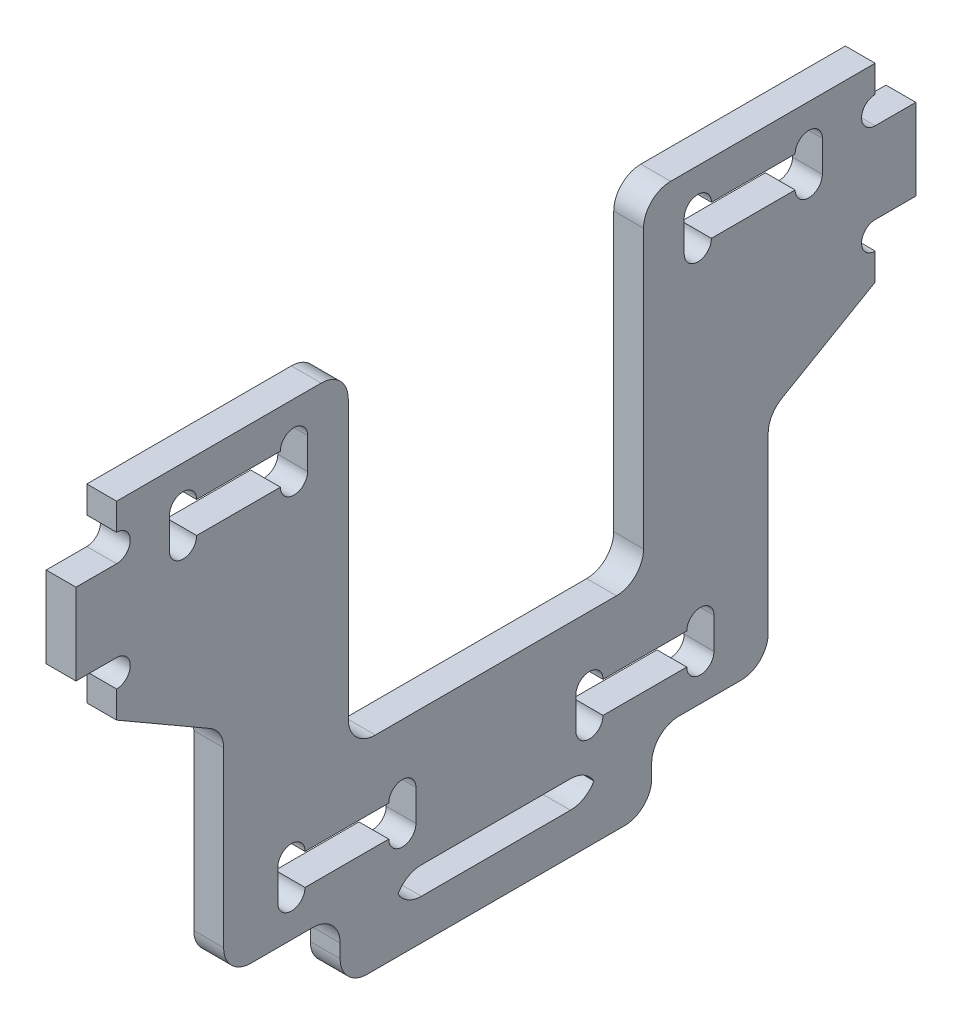
from build123d import *

# Parameters (mm, degrees)
EXTRUDE_1_DEPTH = 2.2
EXTRUDE_2_DEPTH = 2.2
FILLET_1_R      = 2


with BuildPart() as part:
    # 草图1 → 凸台-拉伸1 (new body)
    with BuildSketch(Plane(origin=(0, 0, 0), x_dir=(0, 0, -1), z_dir=(1, 0, 0))):
        with BuildLine():
            Line((-20.1, -17.25), (20.1, -17.25))
            Line((20.1, -17.25), (20.1, -1.311067127))
            Line((20.1, -1.311067127), (28, 3.25))
            Line((28, 3.25), (28, 5.24))
            ThreePointArc((28, 5.24), (26.995, 6.245), (28, 7.25))
            Line((28, 7.25), (31, 7.25))
            Line((31, 7.25), (31, 13.25))
            Line((31, 13.25), (28, 13.25))
            ThreePointArc((28, 13.25), (26.995, 14.255), (28, 15.26))
            Line((28, 15.26), (28, 17.25))
            Line((28, 17.25), (10.9, 17.25))
            Line((10.9, 17.25), (10.9, -7.25))
            Line((10.9, -7.25), (-10.9, -7.25))
            Line((-10.9, -7.25), (-10.9, 17.25))
            Line((-10.9, 17.25), (-28, 17.25))
            Line((-28, 17.25), (-28, 15.26))
            ThreePointArc((-28, 15.26), (-27.289357685, 14.965642315), (-26.995, 14.255))
            ThreePointArc((-26.995, 14.255), (-27.289357685, 13.544357685), (-28, 13.25))
            Line((-28, 13.25), (-31, 13.25))
            Line((-31, 13.25), (-31, 7.25))
            Line((-31, 7.25), (-28, 7.25))
            ThreePointArc((-28, 7.25), (-27.289357685, 6.955642315), (-26.995, 6.245))
            ThreePointArc((-26.995, 6.245), (-27.289357685, 5.534357685), (-28, 5.24))
            Line((-28, 5.24), (-28, 3.25))
            Line((-28, 3.25), (-20.1, -1.311067127))
            Line((-20.1, -1.311067127), (-20.1, -17.25))
        make_face()
        with BuildLine():
            Line((-7.91, -14.4), (-14.09, -14.4))
            ThreePointArc((-14.09, -14.4), (-15.095, -15.405), (-16.1, -14.4))
            Line((-16.1, -14.4), (-16.1, -12.1))
            ThreePointArc((-16.1, -12.1), (-15.095, -11.095), (-14.09, -12.1))
            Line((-14.09, -12.1), (-7.91, -12.1))
            ThreePointArc((-7.91, -12.1), (-6.905, -11.095), (-5.9, -12.1))
            Line((-5.9, -12.1), (-5.9, -14.4))
            ThreePointArc((-5.9, -14.4), (-6.905, -15.405), (-7.91, -14.4))
        make_face(mode=Mode.SUBTRACT)
        with BuildLine():
            Line((16.1, -12.1), (16.1, -14.4))
            ThreePointArc((16.1, -14.4), (15.095, -15.405), (14.09, -14.4))
            Line((14.09, -14.4), (7.91, -14.4))
            ThreePointArc((7.91, -14.4), (6.905, -15.405), (5.9, -14.4))
            Line((5.9, -14.4), (5.9, -12.1))
            ThreePointArc((5.9, -12.1), (6.905, -11.095), (7.91, -12.1))
            Line((7.91, -12.1), (14.09, -12.1))
            ThreePointArc((14.09, -12.1), (15.095, -11.095), (16.1, -12.1))
        make_face(mode=Mode.SUBTRACT)
        with BuildLine():
            Line((-15.91, 12.1), (-22.09, 12.1))
            ThreePointArc((-22.09, 12.1), (-23.095, 11.095), (-24.1, 12.1))
            Line((-24.1, 12.1), (-24.1, 14.4))
            ThreePointArc((-24.1, 14.4), (-23.095, 15.405), (-22.09, 14.4))
            Line((-22.09, 14.4), (-15.91, 14.4))
            ThreePointArc((-15.91, 14.4), (-14.905, 15.405), (-13.9, 14.4))
            Line((-13.9, 14.4), (-13.9, 12.1))
            ThreePointArc((-13.9, 12.1), (-14.905, 11.095), (-15.91, 12.1))
        make_face(mode=Mode.SUBTRACT)
        with BuildLine():
            Line((13.9, 12.1), (13.9, 14.4))
            ThreePointArc((13.9, 14.4), (14.905, 15.405), (15.91, 14.4))
            Line((15.91, 14.4), (22.09, 14.4))
            ThreePointArc((22.09, 14.4), (23.095, 15.405), (24.1, 14.4))
            Line((24.1, 14.4), (24.1, 12.1))
            ThreePointArc((24.1, 12.1), (23.095, 11.095), (22.09, 12.1))
            Line((22.09, 12.1), (15.91, 12.1))
            ThreePointArc((15.91, 12.1), (14.905, 11.095), (13.9, 12.1))
        make_face(mode=Mode.SUBTRACT)
    extrude(amount=EXTRUDE_1_DEPTH)

    # 草图2 → 凸台-拉伸2 (add)
    with BuildSketch(Plane(origin=(2.2, 0, 0), x_dir=(0, 0, -1), z_dir=(1, 0, 0))):
        Polygon((-11.5, -17.25), (-11.5, -22.25), (11.5, -22.25), (11.5, -17.25), (7.5, -17.25), (7.5, -19.26), (-7.5, -19.26), (-7.5, -17.25), align=None)
    extrude(amount=-EXTRUDE_2_DEPTH)

    # 圆角1
    # the kernel refuses this fillet: 2 mm, written as the material it adds along each edge
    with BuildSketch(Plane(origin=(0, -1.311067127, -20.1), x_dir=(0, -1, 0), z_dir=(1, 0, 0)), Plane(origin=(0, -1.311067127, 20.1), x_dir=(0, 0.49999999999999634, 0.8660254037844408), z_dir=(1, 0, 0))) as fillet_1_piece_1:
        with BuildLine():
            CenterArc((FILLET_1_R * 0.57735026919, FILLET_1_R), FILLET_1_R, 210, 60)
            Line((-FILLET_1_R * 0.288675134595, FILLET_1_R * 0.5), (0, 0))
            Line((0, 0), (FILLET_1_R * 0.57735026919, 0))
        make_face()
    extrude(amount=2.2)
    with BuildSketch(Plane(origin=(0, -7.25, -10.9), x_dir=(0, 1, 0), z_dir=(1, 0, 0)), Plane(origin=(0, -7.25, 10.9), x_dir=(0, 0, -1), z_dir=(1, 0, 0)), Plane(origin=(2.2, -17.25, 7.5), x_dir=(0, 0, -1), z_dir=(-1, 0, 0)), Plane(origin=(2.2, -17.25, -11.5), x_dir=(0, 0, -1), z_dir=(-1, 0, 0))) as fillet_1_piece_2:
        with BuildLine():
            CenterArc((FILLET_1_R, FILLET_1_R), FILLET_1_R, 180, 90)
            Line((0, FILLET_1_R), (0, 0))
            Line((0, 0), (FILLET_1_R, 0))
        make_face()
    extrude(amount=2.2)
    with BuildSketch(Plane(origin=(2.2, -19.26, -7.5), x_dir=(0, 1, 0), z_dir=(-1, 0, 0)), Plane(origin=(2.2, -19.26, 7.5), x_dir=(0, 0, -1), z_dir=(-1, 0, 0)), Plane(origin=(2.2, -17.25, -7.5), x_dir=(0, 0, 1), z_dir=(-1, 0, 0)), Plane(origin=(2.2, -17.25, 11.5), x_dir=(0, 0, 1), z_dir=(-1, 0, 0))) as fillet_1_piece_3:
        with BuildLine():
            CenterArc((FILLET_1_R, -FILLET_1_R), FILLET_1_R, 90, 90)
            Line((0, -FILLET_1_R), (0, 0))
            Line((0, 0), (FILLET_1_R, 0))
        make_face()
    extrude(amount=2.2)
    # the kernel refuses this fillet: 2 mm, written as the material it takes off along each edge
    with BuildSketch(Plane(origin=(-5, -17.25, 20.1), x_dir=(0, 1, 0), z_dir=(1, 0, 0)), Plane(origin=(-5, -17.25, -20.1), x_dir=(0, 0, 1), z_dir=(1, 0, 0)), Plane(origin=(-5, 17.25, -10.9), x_dir=(0, 0, -1), z_dir=(1, 0, 0)), Plane(origin=(-5, 17.25, 10.9), x_dir=(0, -1, 0), z_dir=(1, 0, 0))) as fillet_1_2_piece_1:
        with BuildLine():
            CenterArc((FILLET_1_R, -FILLET_1_R), FILLET_1_R, 90, 90)
            Line((0, -FILLET_1_R), (0, 0))
            Line((0, 0), (FILLET_1_R, 0))
        make_face()
    extrude(amount=12.2, mode=Mode.SUBTRACT)
    with BuildSketch(Plane(origin=(7.2, -22.25, -11.5), x_dir=(0, 0, 1), z_dir=(-1, 0, 0)), Plane(origin=(7.2, -22.25, 11.5), x_dir=(0, 1, 0), z_dir=(-1, 0, 0))) as fillet_1_2_piece_2:
        with BuildLine():
            CenterArc((FILLET_1_R, FILLET_1_R), FILLET_1_R, 180, 90)
            Line((0, FILLET_1_R), (0, 0))
            Line((0, 0), (FILLET_1_R, 0))
        make_face()
    extrude(amount=12.2, mode=Mode.SUBTRACT)


solid = part.part
